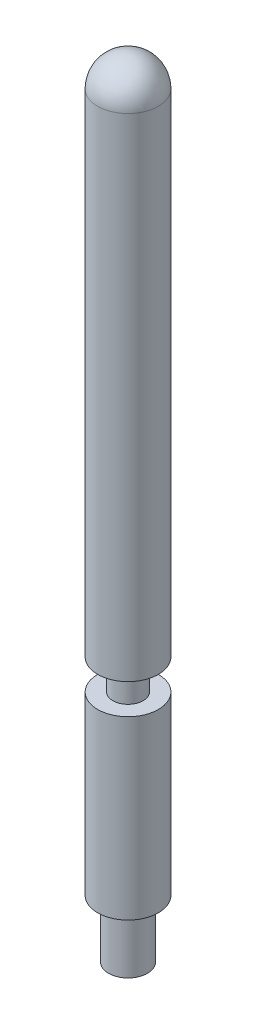
from build123d import *

# Parameters (mm, degrees)
SKETCH1_R           = 5
BOSS_EXTRUDE1_DEPTH = 29
SKETCH2_R           = 2.5
BOSS_EXTRUDE2_DEPTH = 5
SKETCH4_R           = 3.2
BOSS_EXTRUDE3_DEPTH = 9.525


with BuildPart() as part:
    # Sketch1 → Boss-Extrude1 (new body)
    with BuildSketch(Plane(origin=(0, 0, 0), x_dir=(1, 0, 0), z_dir=(0, 1, 0))):
        Circle(SKETCH1_R)
    extrude(amount=BOSS_EXTRUDE1_DEPTH)

    # Sketch2 → Boss-Extrude2 (add)
    with BuildSketch(Plane(origin=(0, 29, 0), x_dir=(1, 0, 0), z_dir=(0, 1, 0))):
        Circle(SKETCH2_R)
    extrude(amount=BOSS_EXTRUDE2_DEPTH)

    # Sketch3 → Revolve1 (revolve)
    with BuildSketch(Plane(origin=(0, 0, 0), x_dir=(0, 0, -1), z_dir=(1, 0, 0))):
        with BuildLine():
            Line((0, 34), (0, 120))
            ThreePointArc((0, 120), (3.535533906, 118.535533906), (5, 115))
            Line((5, 115), (5, 34))
            Line((5, 34), (0, 34))
        make_face()
    revolve(axis=Axis((0, 34, 0), (0, 1, 0)))

    # Sketch4 → Boss-Extrude3 (add)
    with BuildSketch(Plane.XZ):
        Circle(SKETCH4_R)
    extrude(amount=BOSS_EXTRUDE3_DEPTH)


solid = part.part
